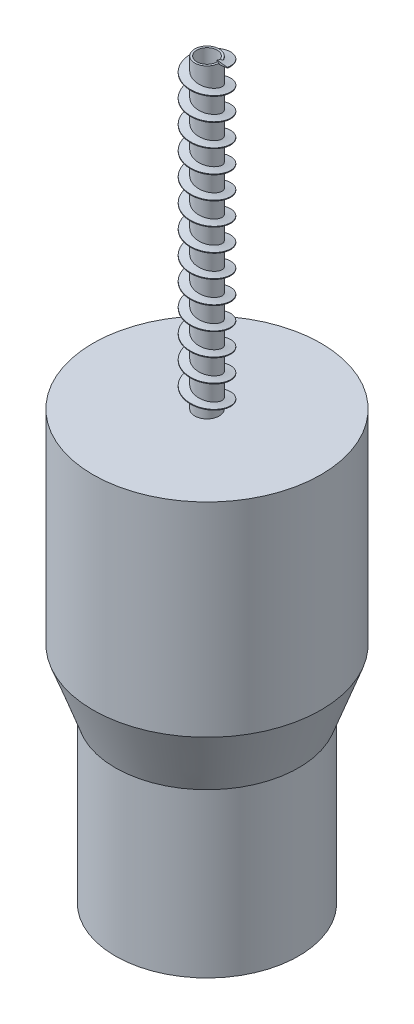
from build123d import *

# Parameters (mm, degrees)
SKETCH1_R               = 45
BOSS_EXTRUDE1_DEPTH     = 80
SKETCH2_R               = 45
BOSS_EXTRUDE2_DEPTH     = 30
BOSS_EXTRUDE2_DRAFT     = -20
SWEEP1_PITCH            = 11.111111111
SKETCH10_R              = 6
BOSS_EXTRUDE4_DEPTH     = 250
CUT_EXTRUDE1_DEPTH      = 148
CUT_EXTRUDE1_DEPTH_BACK = 148
SKETCH11_R              = 5
SKETCH12_R              = 55.919107028
BOSS_EXTRUDE5_DEPTH     = 100


with BuildPart() as part:
    # Sketch1 → Boss-Extrude1 (new body)
    with BuildSketch(Plane(origin=(0, 0, 0), x_dir=(1, 0, 0), z_dir=(0, 1, 0))):
        with Locations(Location((0, 0, 0), (0, 0, 270))):
            Circle(SKETCH1_R)
        with BuildLine():
            Line((0, 16.881943016), (0, 27.928480088))
            ThreePointArc((0, 27.928480088), (-0.637229712, 29.392330197), (-2.142857143, 29.923371522))
            ThreePointArc((-2.142857143, 29.923371522), (-11.480502971, 27.716385975), (-19.643790103, 22.674247736))
            ThreePointArc((-19.643790103, 22.674247736), (-20.332926546, 21.234105448), (-19.748417658, 19.748417658))
            Line((-19.748417658, 19.748417658), (-11.937336386, 11.937336386))
            ThreePointArc((-11.937336386, 11.937336386), (-10.640974667, 11.355025232), (-9.285108374, 11.780779366))
            ThreePointArc((-9.285108374, 11.780779366), (-5.740251485, 13.858192988), (-1.764705882, 14.895832073))
            ThreePointArc((-1.764705882, 14.895832073), (-0.504909997, 15.553520688), (0, 16.881943016))
        make_face(mode=Mode.SUBTRACT)
        with BuildLine():
            Line((11.937336386, 11.937336386), (19.748417658, 19.748417658))
            ThreePointArc((19.748417658, 19.748417658), (21.234105448, 20.332926546), (22.674247736, 19.643790103))
            ThreePointArc((22.674247736, 19.643790103), (27.716385975, 11.480502971), (29.923371522, 2.142857143))
            ThreePointArc((29.923371522, 2.142857143), (29.392330197, 0.637229712), (27.928480088, 0))
            Line((27.928480088, 0), (16.881943016, 0))
            ThreePointArc((16.881943016, 0), (15.553520688, 0.504909997), (14.895832073, 1.764705882))
            ThreePointArc((14.895832073, 1.764705882), (13.858192988, 5.740251485), (11.780779366, 9.285108374))
            ThreePointArc((11.780779366, 9.285108374), (11.355025232, 10.640974667), (11.937336386, 11.937336386))
        make_face(mode=Mode.SUBTRACT)
        with BuildLine():
            Line((11.937336386, -11.937336386), (19.748417658, -19.748417658))
            ThreePointArc((19.748417658, -19.748417658), (20.332926546, -21.234105448), (19.643790103, -22.674247736))
            ThreePointArc((19.643790103, -22.674247736), (11.480502971, -27.716385975), (2.142857143, -29.923371522))
            ThreePointArc((2.142857143, -29.923371522), (0.637229712, -29.392330197), (0, -27.928480088))
            Line((0, -27.928480088), (0, -16.881943016))
            ThreePointArc((0, -16.881943016), (0.504909997, -15.553520688), (1.764705882, -14.895832073))
            ThreePointArc((1.764705882, -14.895832073), (5.740251485, -13.858192988), (9.285108374, -11.780779366))
            ThreePointArc((9.285108374, -11.780779366), (10.640974667, -11.355025232), (11.937336386, -11.937336386))
        make_face(mode=Mode.SUBTRACT)
        with BuildLine():
            Line((-11.937336386, -11.937336386), (-19.748417658, -19.748417658))
            ThreePointArc((-19.748417658, -19.748417658), (-21.234105448, -20.332926546), (-22.674247736, -19.643790103))
            ThreePointArc((-22.674247736, -19.643790103), (-27.716385975, -11.480502971), (-29.923371522, -2.142857143))
            ThreePointArc((-29.923371522, -2.142857143), (-29.392330197, -0.637229712), (-27.928480088, 0))
            Line((-27.928480088, 0), (-16.881943016, 0))
            ThreePointArc((-16.881943016, 0), (-15.553520688, -0.504909997), (-14.895832073, -1.764705882))
            ThreePointArc((-14.895832073, -1.764705882), (-13.858192988, -5.740251485), (-11.780779366, -9.285108374))
            ThreePointArc((-11.780779366, -9.285108374), (-11.355025232, -10.640974667), (-11.937336386, -11.937336386))
        make_face(mode=Mode.SUBTRACT)
    extrude(amount=BOSS_EXTRUDE1_DEPTH)


with BuildPart() as boss_extrude2_tool:
    # Sketch2 → Boss-Extrude2 (with draft: the straight prism first)
    with BuildSketch(Plane(origin=(0, 80, 0), x_dir=(1, 0, 0), z_dir=(0, 1, 0))):
        with Locations(Location((0, 0, 0), (0, 0, 270))):
            Circle(SKETCH2_R)
    extrude(amount=BOSS_EXTRUDE2_DEPTH)
    # Boss-Extrude2: the draft: its side faces are tilted about the plane it starts from
    boss_extrude2_sides = [boss_extrude2_tool.faces().sort_by_distance(p)[0] for p in [
        (0, 95, -45),
    ]]
    draft(boss_extrude2_sides, Plane(origin=(0, 80, 0), x_dir=(1, 0, 0), z_dir=(0, 1, 0)), BOSS_EXTRUDE2_DRAFT)


with BuildPart() as part_1:
    add(part.part)

    # Boss-Extrude2: add boss_extrude2_tool
    add(boss_extrude2_tool.part)

    # Sweep1: the profile of Sketch9 screwed along a left-hand helix of 22.5 turns, 16 arcs to a turn; built about Z, then put on its axis
    sweep1_z = Axis((0, 0, 0), (0, 0, 1))
    sweep1_corners = [(1.417015292, 0, -1.081101086), (1.417015292, 0, 1.081101086), (10, 0, 0.170856924), (10, 0, -0.170856924)]
    with BuildLine(mode=Mode.PRIVATE) as sweep1_profile:
        Line(sweep1_corners[0], sweep1_corners[1])
        Line(sweep1_corners[1], sweep1_corners[2])
        Line(sweep1_corners[2], sweep1_corners[3])
        Line(sweep1_corners[3], sweep1_corners[0])
    sweep1_cap = Face(sweep1_profile.wire())
    sweep1_turn_angles = [0, -11.25, -22.5, -33.75, -45, -56.25, -67.5, -78.75, -90, -101.25, -112.5, -123.75, -135, -146.25, -157.5, -168.75, -180, -191.25, -202.5, -213.75, -225, -236.25, -247.5, -258.75, -270, -281.25, -292.5, -303.75, -315, -326.25, -337.5, -348.75, -360]
    sweep1_turn_weights = [1, 0.9807852804032304, 1, 0.9807852804032304, 1, 0.9807852804032304, 1, 0.9807852804032304, 1, 0.9807852804032304, 1, 0.9807852804032304, 1, 0.9807852804032304, 1, 0.9807852804032304, 1, 0.9807852804032304, 1, 0.9807852804032304, 1, 0.9807852804032304, 1, 0.9807852804032304, 1, 0.9807852804032304, 1, 0.9807852804032304, 1, 0.9807852804032304, 1, 0.9807852804032304, 1]
    sweep1_turn_rails = [Edge.make_bspline([Vector(p[0], p[1], 0).rotate(sweep1_z, sweep1_turn_angles[k]) / sweep1_turn_weights[k] + Vector(0, 0, p[2] + -SWEEP1_PITCH * sweep1_turn_angles[k] / 360) for k in range(33)], [0, 0, 0, 1, 1, 2, 2, 3, 3, 4, 4, 5, 5, 6, 6, 7, 7, 8, 8, 9, 9, 10, 10, 11, 11, 12, 12, 13, 13, 14, 14, 15, 15, 16, 16, 16], 2, sweep1_turn_weights) for p in sweep1_corners]
    sweep1_turn_sides = [Face.make_surface_from_curves(sweep1_turn_rails[p[0]], sweep1_turn_rails[p[1]]) for p in [(0, 1), (1, 2), (2, 3), (3, 0)]]
    sweep1_last_angles = [-7920, -7931.25, -7942.5, -7953.75, -7965, -7976.25, -7987.5, -7998.75, -8010, -8021.25, -8032.5, -8043.75, -8055, -8066.25, -8077.5, -8088.75, -8100]
    sweep1_last_weights = [1, 0.9807852804032304, 1, 0.9807852804032304, 1, 0.9807852804032304, 1, 0.9807852804032304, 1, 0.9807852804032304, 1, 0.9807852804032304, 1, 0.9807852804032304, 1, 0.980785280403071, 1]
    sweep1_last_rails = [Edge.make_bspline([Vector(p[0], p[1], 0).rotate(sweep1_z, sweep1_last_angles[k]) / sweep1_last_weights[k] + Vector(0, 0, p[2] + -SWEEP1_PITCH * sweep1_last_angles[k] / 360) for k in range(17)], [0, 0, 0, 1, 1, 2, 2, 3, 3, 4, 4, 5, 5, 6, 6, 7, 7, 8, 8, 8], 2, sweep1_last_weights) for p in sweep1_corners]
    sweep1_last_sides = [Face.make_surface_from_curves(sweep1_last_rails[p[0]], sweep1_last_rails[p[1]]) for p in [(0, 1), (1, 2), (2, 3), (3, 0)]]
    sweep1 = Plane(origin=(0, 110, 0), x_dir=(-1, 0, 0), z_dir=(0, 1, 0)) * Solid(Shell([*[p.moved(Location((0, 0, SWEEP1_PITCH * i))) for i in range(22) for p in sweep1_turn_sides], *sweep1_last_sides, sweep1_cap, sweep1_cap.rotate(sweep1_z, -8100).moved(Location((0, 0, -SWEEP1_PITCH * -8100 / 360)))]))
    add(sweep1)

    # Sketch10 → Boss-Extrude4 (add)
    with BuildSketch(Plane(origin=(0, 110, 0), x_dir=(1, 0, 0), z_dir=(0, 1, 0))):
        Circle(SKETCH10_R)
    extrude(amount=BOSS_EXTRUDE4_DEPTH)

    # Sketch11 → Cut-Extrude1 (cut, two sides: drawn at the far end of the back side and taken through both)
    with BuildSketch(Plane(origin=(0, 360, 0), x_dir=(1, 0, 0), z_dir=(0, 1, 0)).offset(-CUT_EXTRUDE1_DEPTH_BACK)):
        with Locations(Location((0, 0, 0), (0, 0, 22.718955477))):
            Circle(SKETCH11_R)
    extrude(amount=CUT_EXTRUDE1_DEPTH + CUT_EXTRUDE1_DEPTH_BACK, mode=Mode.SUBTRACT)

    # Sketch12 → Boss-Extrude5 (add)
    with BuildSketch(Plane(origin=(0, 110, 0), x_dir=(1, 0, 0), z_dir=(0, 1, 0))):
        with Locations(Location((0, 0, 0), (0, 0, 270))):
            Circle(SKETCH12_R)
    extrude(amount=BOSS_EXTRUDE5_DEPTH)


solid = part_1.part
